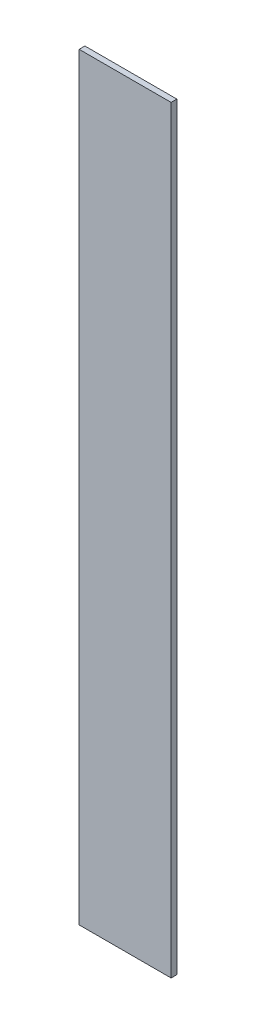
from build123d import *

# Parameters (mm, degrees)
SKETCH1_W           = 25.4
SKETCH1_H           = 209.55
BOSS_EXTRUDE1_DEPTH = 1.5875


with BuildPart() as part:
    # Sketch1 → Boss-Extrude1 (new body)
    with BuildSketch(Plane.XY):
        with Locations((12.7, 104.775)):
            Rectangle(SKETCH1_W, SKETCH1_H)
    extrude(amount=BOSS_EXTRUDE1_DEPTH)


solid = part.part
